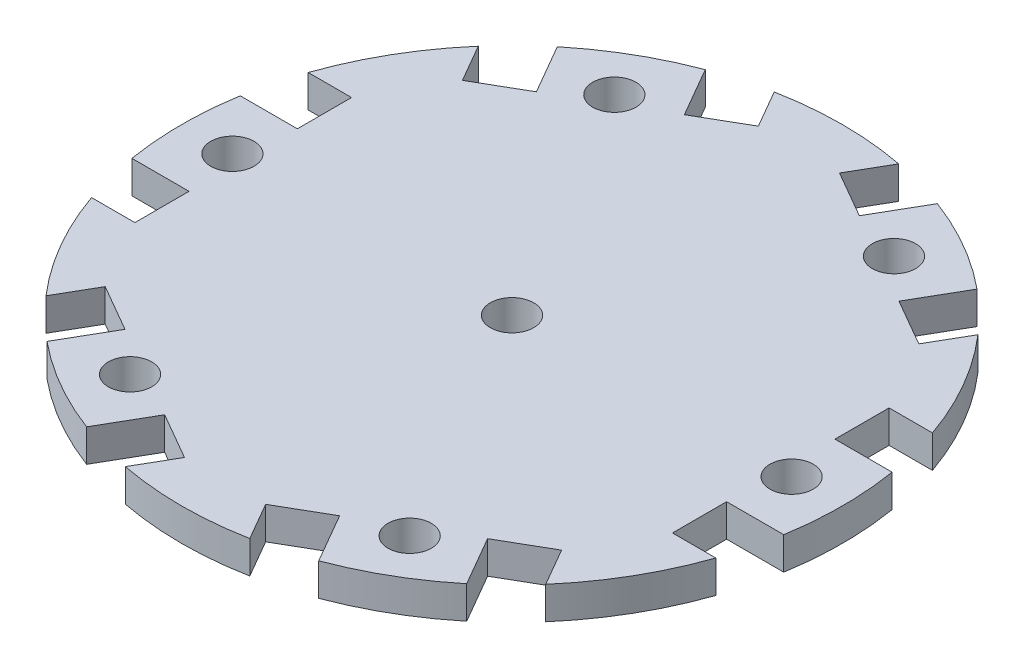
from build123d import *

# Parameters (mm, degrees)
CROQUIS1_R              = 30.5
SALIENTE_EXTRUIR1_DEPTH = 3
CROQUIS2_R              = 2
CORTAR_EXTRUIR1_DEPTH   = 4
CORTAR_EXTRUIR3_START   = -4
CORTAR_EXTRUIR3_DEPTH   = 4
CROQUIS7_R              = 2
CORTAR_EXTRUIR4_DEPTH   = 10


with BuildPart() as part:
    # Croquis1 → Saliente-Extruir1 (new body)
    with BuildSketch(Plane(origin=(0, 0, 0), x_dir=(1, 0, 0), z_dir=(0, 1, 0))):
        Circle(CROQUIS1_R)
    extrude(amount=SALIENTE_EXTRUIR1_DEPTH)

    # Croquis2 → Cortar-Extruir1 (cut)
    with BuildSketch(Plane(origin=(0, 3, 0), x_dir=(1, 0, 0), z_dir=(0, 1, 0))):
        Circle(CROQUIS2_R)
    extrude(amount=-CORTAR_EXTRUIR1_DEPTH, mode=Mode.SUBTRACT)

    # Croquis5 → Cortar-Extruir3 (cut)
    with BuildSketch(Plane(origin=(0, 3, 0), x_dir=(1, 0, 0), z_dir=(0, 1, 0)).offset(CORTAR_EXTRUIR3_START)):
        with BuildLine():
            Line((30.087372767, -5), (24.814059068, -5))
            Line((24.814059068, -5), (24.814059068, -10))
            Line((24.814059068, -10), (28.814059068, -10))
            ThreePointArc((28.814059068, -10), (29.556634924, -7.526973624), (30.087372767, -5))
        make_face()
        with BuildLine():
            ThreePointArc((19.373813402, -23.556429149), (21.296867835, -21.833309883), (23.067283572, -19.953707139))
            Line((23.067283572, -19.953707139), (21.067283572, -16.489605524))
            Line((21.067283572, -16.489605524), (16.737156553, -18.989605524))
            Line((16.737156553, -18.989605524), (19.373813402, -23.556429149))
        make_face()
        with BuildLine():
            Line((24.814059068, 5), (30.087372767, 5))
            ThreePointArc((30.087372767, 5), (29.556634924, 7.526973624), (28.814059068, 10))
            Line((28.814059068, 10), (24.814059068, 10))
            Line((24.814059068, 10), (24.814059068, 5))
        make_face()
        with BuildLine():
            ThreePointArc((5.746775496, -29.953707139), (8.25976709, -29.360283507), (10.713559364, -28.556429149))
            Line((10.713559364, -28.556429149), (8.076902515, -23.989605524))
            Line((8.076902515, -23.989605524), (3.746775496, -26.489605524))
            Line((3.746775496, -26.489605524), (5.746775496, -29.953707139))
        make_face()
        with BuildLine():
            Line((21.067283572, 16.489605524), (23.067283572, 19.953707139))
            ThreePointArc((23.067283572, 19.953707139), (21.296867835, 21.833309883), (19.373813402, 23.556429149))
            Line((19.373813402, 23.556429149), (16.737156553, 18.989605524))
            Line((16.737156553, 18.989605524), (21.067283572, 16.489605524))
        make_face()
        with BuildLine():
            ThreePointArc((-10.713559364, -28.556429149), (-8.25976709, -29.360283507), (-5.746775496, -29.953707139))
            Line((-5.746775496, -29.953707139), (-3.746775496, -26.489605524))
            Line((-3.746775496, -26.489605524), (-8.076902515, -23.989605524))
            Line((-8.076902515, -23.989605524), (-10.713559364, -28.556429149))
        make_face()
        with BuildLine():
            Line((8.076902515, 23.989605524), (10.713559364, 28.556429149))
            ThreePointArc((10.713559364, 28.556429149), (8.25976709, 29.360283507), (5.746775496, 29.953707139))
            Line((5.746775496, 29.953707139), (3.746775496, 26.489605524))
            Line((3.746775496, 26.489605524), (8.076902515, 23.989605524))
        make_face()
        with BuildLine():
            ThreePointArc((-23.067283572, -19.953707139), (-21.296867835, -21.833309883), (-19.373813402, -23.556429149))
            Line((-19.373813402, -23.556429149), (-16.737156553, -18.989605524))
            Line((-16.737156553, -18.989605524), (-21.067283572, -16.489605524))
            Line((-21.067283572, -16.489605524), (-23.067283572, -19.953707139))
        make_face()
        with BuildLine():
            Line((-3.746775496, 26.489605524), (-5.746775496, 29.953707139))
            ThreePointArc((-5.746775496, 29.953707139), (-8.25976709, 29.360283507), (-10.713559364, 28.556429149))
            Line((-10.713559364, 28.556429149), (-8.076902515, 23.989605524))
            Line((-8.076902515, 23.989605524), (-3.746775496, 26.489605524))
        make_face()
        with BuildLine():
            ThreePointArc((-30.087372767, -5), (-29.556634924, -7.526973624), (-28.814059068, -10))
            Line((-28.814059068, -10), (-24.814059068, -10))
            Line((-24.814059068, -10), (-24.814059068, -5))
            Line((-24.814059068, -5), (-30.087372767, -5))
        make_face()
        with BuildLine():
            Line((-16.737156553, 18.989605524), (-19.373813402, 23.556429149))
            ThreePointArc((-19.373813402, 23.556429149), (-21.296867835, 21.833309883), (-23.067283572, 19.953707139))
            Line((-23.067283572, 19.953707139), (-21.067283572, 16.489605524))
            Line((-21.067283572, 16.489605524), (-16.737156553, 18.989605524))
        make_face()
        with BuildLine():
            ThreePointArc((-28.814059068, 10), (-29.556634924, 7.526973624), (-30.087372767, 5))
            Line((-30.087372767, 5), (-24.814059068, 5))
            Line((-24.814059068, 5), (-24.814059068, 10))
            Line((-24.814059068, 10), (-28.814059068, 10))
        make_face()
    extrude(amount=CORTAR_EXTRUIR3_DEPTH, mode=Mode.SUBTRACT)

    # Croquis7 → Cortar-Extruir4 (cut)
    with BuildSketch(Plane(origin=(0, 3, 0), x_dir=(1, 0, 0), z_dir=(0, 1, 0))):
        with Locations((25.81405907, 0)):
            Circle(CROQUIS7_R)
        with Locations((12.907029535, 22.355630929)):
            Circle(CROQUIS7_R)
        with Locations((12.907029535, -22.355630929)):
            Circle(CROQUIS7_R)
        with Locations((-12.907029535, 22.355630929)):
            Circle(CROQUIS7_R)
        with Locations((-12.907029535, -22.355630929)):
            Circle(CROQUIS7_R)
        with Locations((-25.81405907, 0)):
            Circle(CROQUIS7_R)
    extrude(amount=-CORTAR_EXTRUIR4_DEPTH, mode=Mode.SUBTRACT)


solid = part.part
